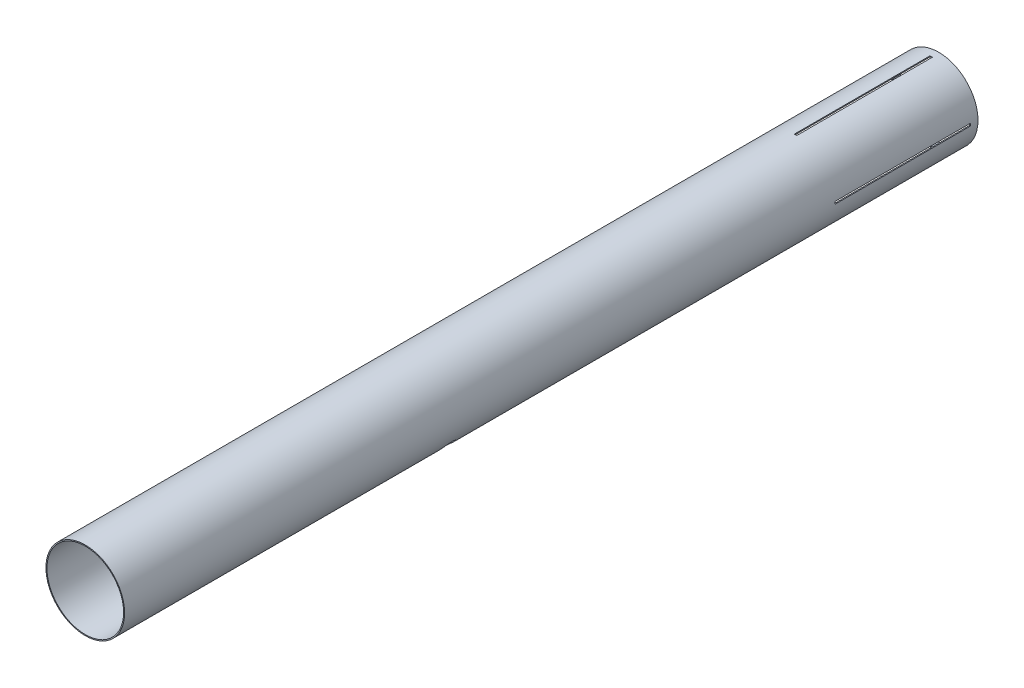
from build123d import *

# Parameters (mm, degrees)
SKETCH1_R           = 78.35
SKETCH1_R_2         = 76.35
BOSS_EXTRUDE1_DEPTH = 1700
SKETCH5_R           = 15
CUT_EXTRUDE2_DEPTH  = 1704.607186237
SKETCH6_W           = 4.8
SKETCH6_H           = 270
CUT_EXTRUDE3_DEPTH  = 1704.607186346
CIRPATTERN1_COUNT   = 2
CIRPATTERN1_ANGLE   = 90


with BuildPart() as part:
    # Sketch1 → Boss-Extrude1 (new body)
    with BuildSketch(Plane.XY):
        Circle(SKETCH1_R)
        Circle(SKETCH1_R_2, mode=Mode.SUBTRACT)
    extrude(amount=BOSS_EXTRUDE1_DEPTH)

    # Sketch5 → Cut-Extrude2 (cut, through all)
    with BuildSketch(Plane(origin=(0, 0, 0), x_dir=(0, 0, -1), z_dir=(0.7071067811865489, -0.7071067811865462, 0))):
        with Locations((-1034.89, 0)):
            Circle(SKETCH5_R)
    extrude(amount=CUT_EXTRUDE2_DEPTH, mode=Mode.SUBTRACT)

    # Sketch6 → Cut-Extrude3 (cut, symmetric)
    with BuildSketch(Plane(origin=(0, 0, 0), x_dir=(1, 0, 0), z_dir=(0, 1, 0))):
        with Locations((0, -150)):
            Rectangle(SKETCH6_W, SKETCH6_H)
    cut_extrude3 = extrude(amount=CUT_EXTRUDE3_DEPTH, both=True, mode=Mode.SUBTRACT)

    # CirPattern1: Cut-Extrude3 ×2 about axis
    cirpattern1_axis = Axis((0, 0, 0), (0, 0, 1))
    for i in range(1, CIRPATTERN1_COUNT):
        add(cut_extrude3.rotate(cirpattern1_axis, i * CIRPATTERN1_ANGLE / (CIRPATTERN1_COUNT - 1)), mode=Mode.SUBTRACT)


solid = part.part
